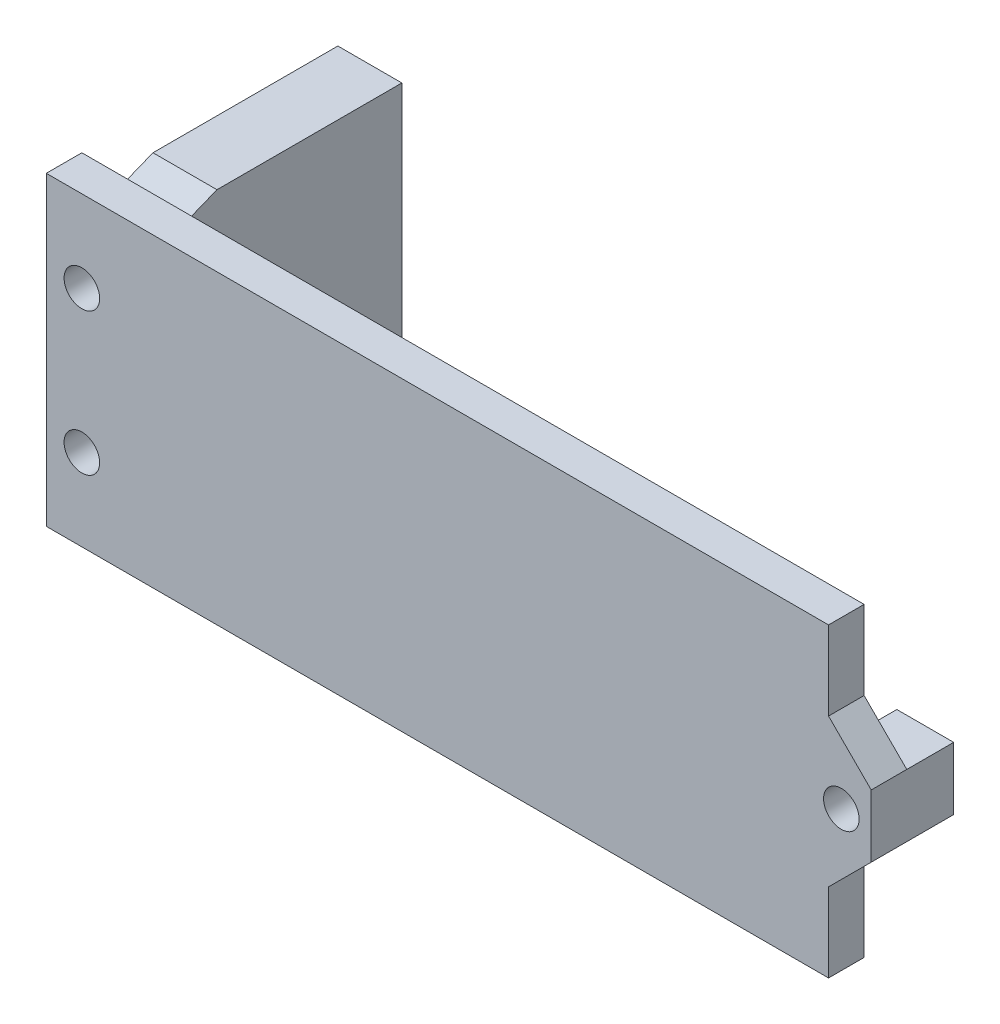
from build123d import *
from build123d.topology import SkipClean

# Parameters (mm, degrees)
SKETCH1_R           = 1.5875
BOSS_EXTRUDE1_DEPTH = 3.175
BOSS_EXTRUDE2_START = -22.86
SKETCH1_3_W         = 5.715
SKETCH1_3_H         = 20.955
SKETCH1_3_R         = 1.5875
BOSS_EXTRUDE2_DEPTH = 22.86
BOSS_EXTRUDE3_START = -4.191
BOSS_EXTRUDE3_DEPTH = 4.191
CHAMFER1_SIZE       = 3.81
SKETCH3_W           = 69.85
SKETCH3_H           = 3.175
BOSS_EXTRUDE4_DEPTH = 3.175
CUT_EXTRUDE6_DEPTH  = 76.639668991


with BuildPart() as part:
    # Sketch1 → Boss-Extrude1 (new body)
    with BuildSketch(Plane.XY):
        Polygon((0, 20.955), (-69.85, 20.955), (-69.85, 0), (0, 0), (0, 7.6835), (3.81, 7.6835), (3.81, 13.2715), (0, 13.2715), align=None)
        with Locations((-66.675, 16.8275)):
            Circle(SKETCH1_R, mode=Mode.SUBTRACT)
        with Locations((-66.675, 4.1275)):
            Circle(SKETCH1_R, mode=Mode.SUBTRACT)
        with Locations((1.143, 10.4775)):
            Circle(SKETCH1_R, mode=Mode.SUBTRACT)
    extrude(amount=BOSS_EXTRUDE1_DEPTH)

    # Sketch1<3> → Boss-Extrude2 (add)
    with BuildSketch(Plane.XY.offset(BOSS_EXTRUDE2_START)):
        with Locations((-66.9925, 10.4775)):
            Rectangle(SKETCH1_3_W, SKETCH1_3_H)
        with Locations((-66.675, 4.1275)):
            Circle(SKETCH1_3_R, mode=Mode.SUBTRACT)
        with Locations((-66.675, 16.8275)):
            Circle(SKETCH1_3_R, mode=Mode.SUBTRACT)
    extrude(amount=BOSS_EXTRUDE2_DEPTH)

    # Sketch1<4> → Boss-Extrude3 (add)
    with SkipClean():  # the faces are left unmerged after this step: merging them gives an invalid solid
        with BuildSketch(Plane.XY.offset(BOSS_EXTRUDE3_START)):
            with BuildLine():
                Line((3.81, 13.2715), (0, 13.2715))
                Line((0, 13.2715), (0, 11.579183825))
                ThreePointArc((0, 11.579183825), (1.73698811, 11.949686936), (2.7305, 10.4775))
                ThreePointArc((2.7305, 10.4775), (1.73698811, 9.005313064), (0, 9.375816175))
                Line((0, 9.375816175), (0, 7.6835))
                Line((0, 7.6835), (3.81, 7.6835))
                Line((3.81, 7.6835), (3.81, 13.2715))
            make_face()
            with BuildLine():
                Line((0, 11.579183825), (0, 13.2715))
                Line((0, 13.2715), (-1.27, 13.2715))
                Line((-1.27, 13.2715), (-1.27, 7.6835))
                Line((-1.27, 7.6835), (0, 7.6835))
                Line((0, 7.6835), (0, 9.375816175))
                ThreePointArc((0, 9.375816175), (-0.4445, 10.4775), (0, 11.579183825))
            make_face()
        extrude(amount=BOSS_EXTRUDE3_DEPTH)

    # Chamfer1
    # the kernel refuses this chamfer: 3.81 mm, written as the material it adds along each edge
    with BuildSketch(Plane(origin=(0, 7.6835, 0), x_dir=(-0.027495876610586462, -0.9996219169112968, 0), z_dir=(0, 0, 1))) as chamfer1_piece_1_section:
        Polygon((CHAMFER1_SIZE * 0.999621916911, CHAMFER1_SIZE * 0.0274958766106), (-CHAMFER1_SIZE * 0.0274958766106, CHAMFER1_SIZE * 0.999621916911), (0, 0), align=None)
    chamfer1_piece_1 = extrude(amount=3.175, mode=Mode.PRIVATE)
    chamfer1_piece_1 = split(chamfer1_piece_1, bisect_by=Plane(origin=(3.81, 6.424660172, 1.5875), z_dir=(-1, 0, 0)), keep=Keep.TOP, mode=Mode.PRIVATE)
    add(chamfer1_piece_1)
    with BuildSketch(Plane(origin=(0, 13.2715, 0), x_dir=(-0.027495876610586452, 0.9996219169112968, 0), z_dir=(0, 0, 1))) as chamfer1_piece_2_section:
        Polygon((CHAMFER1_SIZE * 0.999621916911, -CHAMFER1_SIZE * 0.0274958766106), (-CHAMFER1_SIZE * 0.0274958766106, -CHAMFER1_SIZE * 0.999621916911), (0, 0), align=None)
    chamfer1_piece_2 = extrude(amount=3.175, mode=Mode.PRIVATE)
    chamfer1_piece_2 = split(chamfer1_piece_2, bisect_by=Plane(origin=(3.81, 14.530339828, 1.5875), z_dir=(-1, 0, 0)), keep=Keep.TOP, mode=Mode.PRIVATE)
    add(chamfer1_piece_2)

    # Sketch3 → Boss-Extrude4 (add)
    with BuildSketch(Plane(origin=(0, 20.955, 0), x_dir=(1, 0, 0), z_dir=(0, 1, 0))):
        with Locations((-34.925, -1.5875)):
            Rectangle(SKETCH3_W, SKETCH3_H)
    boss_extrude4 = extrude(amount=BOSS_EXTRUDE4_DEPTH)

    # Mirror1: Boss-Extrude4 across plane
    add(boss_extrude4.mirror(Plane(origin=(0, 10.4775, 0), x_dir=(0, 0, 1), z_dir=(0, -1, 0))))

    # Sketch6 → Cut-Extrude6 (cut, through all)
    with BuildSketch(Plane(origin=(-64.135, 0, 0), x_dir=(0, 0, -1), z_dir=(1, 0, 0))):
        Polygon((0, 20.955), (3.175, 19.685), (6.35, 20.955), align=None)
        Polygon((3.175, 1.27), (6.35, 0), (0, 0), align=None)
    extrude(amount=-CUT_EXTRUDE6_DEPTH, mode=Mode.SUBTRACT)


solid = part.part
